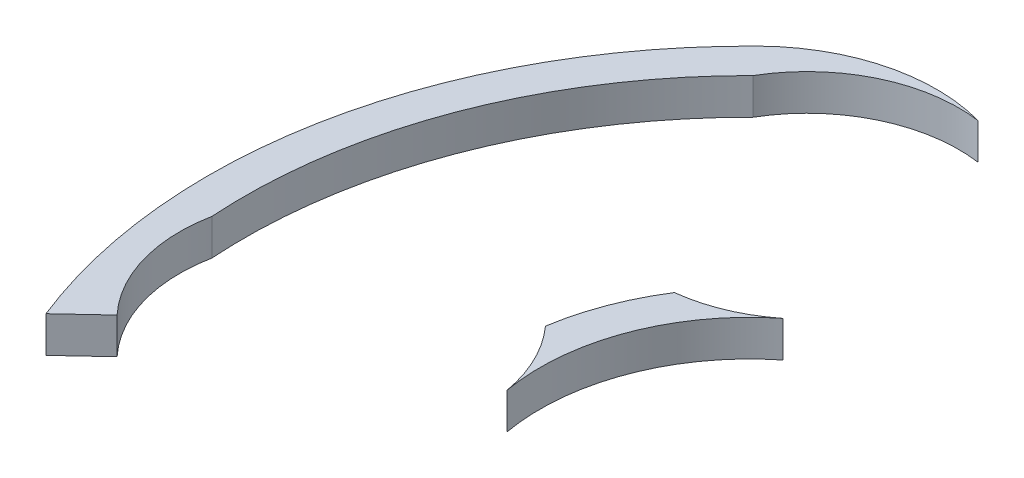
from build123d import *

# Parameters (mm, degrees)
BOSS_EXTRU_1_DEPTH   = 5
BOSS_EXTRU_1_2_DEPTH = 5


with BuildPart() as part:
    # Esquisse1 → Boss.-Extru.1 (new body)
    with BuildSketch(Plane(origin=(0, 0, 0), x_dir=(1, 0, 0), z_dir=(0, 1, 0))):
        with BuildLine():
            ThreePointArc((-68.670306383, 42.279177512), (-89.686909751, 4.154853404), (-85.986425434, -39.22103992))
            Line((-85.986425434, -39.22103992), (-80.900990435, -34.464540644))
            ThreePointArc((-80.900990435, -34.464540644), (-85.751719928, -25.903787737), (-86.17049139, -16.073187685))
            ThreePointArc((-86.17049139, -16.073187685), (-81.791772572, 13.347522582), (-65.59218562, 38.293960276))
            ThreePointArc((-65.59218562, 38.293960276), (-56.648553434, 46.570078495), (-44.614859749, 48.486561147))
            ThreePointArc((-44.614859749, 48.486561147), (-57.468209941, 48.582417546), (-68.670306383, 42.279177512))
        make_face()
    extrude(amount=BOSS_EXTRU_1_DEPTH)


with BuildPart() as body_2:
    # Esquisse1 → Boss.-Extru.1 2 (new body)
    with BuildSketch(Plane(origin=(0, 0, 0), x_dir=(1, 0, 0), z_dir=(0, 1, 0))):
        with BuildLine():
            ThreePointArc((-45.005569477, 6.826903522), (-48.122892622, 0.603640798), (-49.907579974, -6.124032915))
            ThreePointArc((-49.907579974, -6.124032915), (-46.673295144, -10.946787783), (-44.883425416, -16.470910269))
            ThreePointArc((-44.883425416, -16.470910269), (-43.446659296, -1.166342783), (-34.389436177, 11.253834034))
            ThreePointArc((-34.389436177, 11.253834034), (-39.388504997, 8.299367279), (-45.005569477, 6.826903522))
        make_face()
    extrude(amount=BOSS_EXTRU_1_2_DEPTH)


solid = Compound([part.part, body_2.part])
